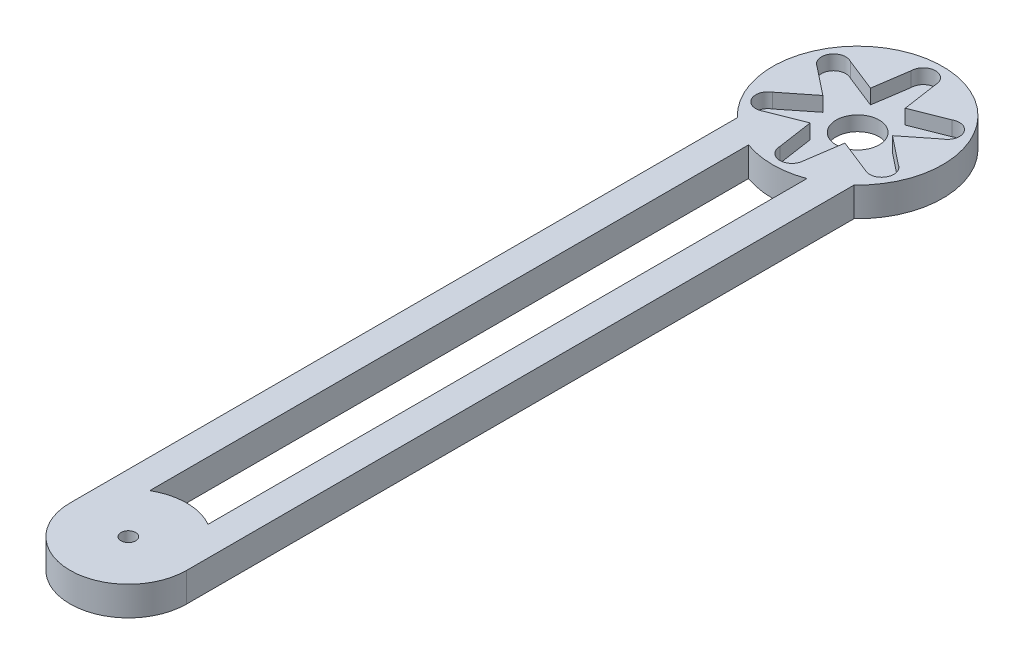
from build123d import *

# Parameters (mm, degrees)
SKETCH1_R           = 17.5
BOSS_EXTRUDE3_DEPTH = 6
SKETCH1_11_R        = 4.425
BOSS_EXTRUDE5_DEPTH = 3
SKETCH2_R           = 1.5
BOSS_EXTRUDE6_DEPTH = 6


with BuildPart() as part:
    # Sketch1 → Boss-Extrude3 (new body)
    with BuildSketch(Plane(origin=(0, 0, 0), x_dir=(1, 0, 0), z_dir=(0, 1, 0))):
        Circle(SKETCH1_R)
        with BuildLine():
            ThreePointArc((-2.5, 13.5), (-1.767766953, 15.267766953), (0, 16))
            ThreePointArc((0, 16), (1.767766953, 15.267766953), (2.5, 13.5))
            Line((2.5, 13.5), (3.581091494, 6.202632414))
            Line((3.581091494, 6.202632414), (10.441342951, 8.915063509))
            ThreePointArc((10.441342951, 8.915063509), (12.338390564, 9.164814566), (13.856406461, 8))
            ThreePointArc((13.856406461, 8), (14.106157517, 7.397047613), (14.191342951, 6.75))
            ThreePointArc((14.191342951, 6.75), (13.856406461, 5.5), (12.941342951, 4.584936491))
            Line((12.941342951, 4.584936491), (7.162182988, 0))
            Line((7.162182988, 0), (12.941342951, -4.584936491))
            ThreePointArc((12.941342951, -4.584936491), (13.856406461, -5.5), (14.191342951, -6.75))
            ThreePointArc((14.191342951, -6.75), (14.106157517, -7.397047613), (13.856406461, -8))
            ThreePointArc((13.856406461, -8), (12.338390564, -9.164814566), (10.441342951, -8.915063509))
            Line((10.441342951, -8.915063509), (3.581091494, -6.202632414))
            Line((3.581091494, -6.202632414), (2.5, -13.5))
            ThreePointArc((2.5, -13.5), (1.767766953, -15.267766953), (0, -16))
            ThreePointArc((0, -16), (-1.767766953, -15.267766953), (-2.5, -13.5))
            Line((-2.5, -13.5), (-3.581091494, -6.202632414))
            Line((-3.581091494, -6.202632414), (-10.441342951, -8.915063509))
            ThreePointArc((-10.441342951, -8.915063509), (-12.338390564, -9.164814566), (-13.856406461, -8))
            ThreePointArc((-13.856406461, -8), (-14.106157517, -6.102952387), (-12.941342951, -4.584936491))
            Line((-12.941342951, -4.584936491), (-7.162182988, 0))
            Line((-7.162182988, 0), (-12.941342951, 4.584936491))
            ThreePointArc((-12.941342951, 4.584936491), (-14.106157517, 6.102952387), (-13.856406461, 8))
            ThreePointArc((-13.856406461, 8), (-12.338390564, 9.164814566), (-10.441342951, 8.915063509))
            Line((-10.441342951, 8.915063509), (-3.581091494, 6.202632414))
            Line((-3.581091494, 6.202632414), (-2.5, 13.5))
        make_face(mode=Mode.SUBTRACT)
    extrude(amount=BOSS_EXTRUDE3_DEPTH)

    # Sketch1<11> → Boss-Extrude5 (add)
    with BuildSketch(Plane(origin=(0, 0, 0), x_dir=(1, 0, 0), z_dir=(0, 1, 0))):
        with BuildLine():
            Line((-2.5, 13.5), (-3.581091494, 6.202632414))
            Line((-3.581091494, 6.202632414), (-10.441342951, 8.915063509))
            ThreePointArc((-10.441342951, 8.915063509), (-13.856406461, 8), (-12.941342951, 4.584936491))
            Line((-12.941342951, 4.584936491), (-7.162182988, 0))
            Line((-7.162182988, 0), (-12.941342951, -4.584936491))
            ThreePointArc((-12.941342951, -4.584936491), (-13.856406461, -8), (-10.441342951, -8.915063509))
            Line((-10.441342951, -8.915063509), (-3.581091494, -6.202632414))
            Line((-3.581091494, -6.202632414), (-2.5, -13.5))
            ThreePointArc((-2.5, -13.5), (0, -16), (2.5, -13.5))
            Line((2.5, -13.5), (3.581091494, -6.202632414))
            Line((3.581091494, -6.202632414), (10.441342951, -8.915063509))
            ThreePointArc((10.441342951, -8.915063509), (13.856406461, -8), (12.941342951, -4.584936491))
            Line((12.941342951, -4.584936491), (7.162182988, 0))
            Line((7.162182988, 0), (12.941342951, 4.584936491))
            ThreePointArc((12.941342951, 4.584936491), (13.856406461, 8), (10.441342951, 8.915063509))
            Line((10.441342951, 8.915063509), (3.581091494, 6.202632414))
            Line((3.581091494, 6.202632414), (2.5, 13.5))
            ThreePointArc((2.5, 13.5), (0, 16), (-2.5, 13.5))
        make_face()
        Circle(SKETCH1_11_R, mode=Mode.SUBTRACT)
    extrude(amount=BOSS_EXTRUDE5_DEPTH)

    # Sketch2 → Boss-Extrude6 (add)
    with BuildSketch(Plane.XZ):
        with BuildLine():
            Line((-12, 150), (-12, 12.737739203))
            ThreePointArc((-12, 12.737739203), (-9.188327116, 14.893778729), (-6, 16.439282223))
            Line((-6, 16.439282223), (-6, 139.607695155))
            ThreePointArc((-6, 139.607695155), (0, 138), (6, 139.607695155))
            Line((6, 139.607695155), (6, 16.439282223))
            ThreePointArc((6, 16.439282223), (9.188327116, 14.893778729), (12, 12.737739203))
            Line((12, 12.737739203), (12, 150))
            ThreePointArc((12, 150), (0, 162), (-12, 150))
        make_face()
        with Locations((0, 150)):
            Circle(SKETCH2_R, mode=Mode.SUBTRACT)
    extrude(amount=-BOSS_EXTRUDE6_DEPTH)


solid = part.part
